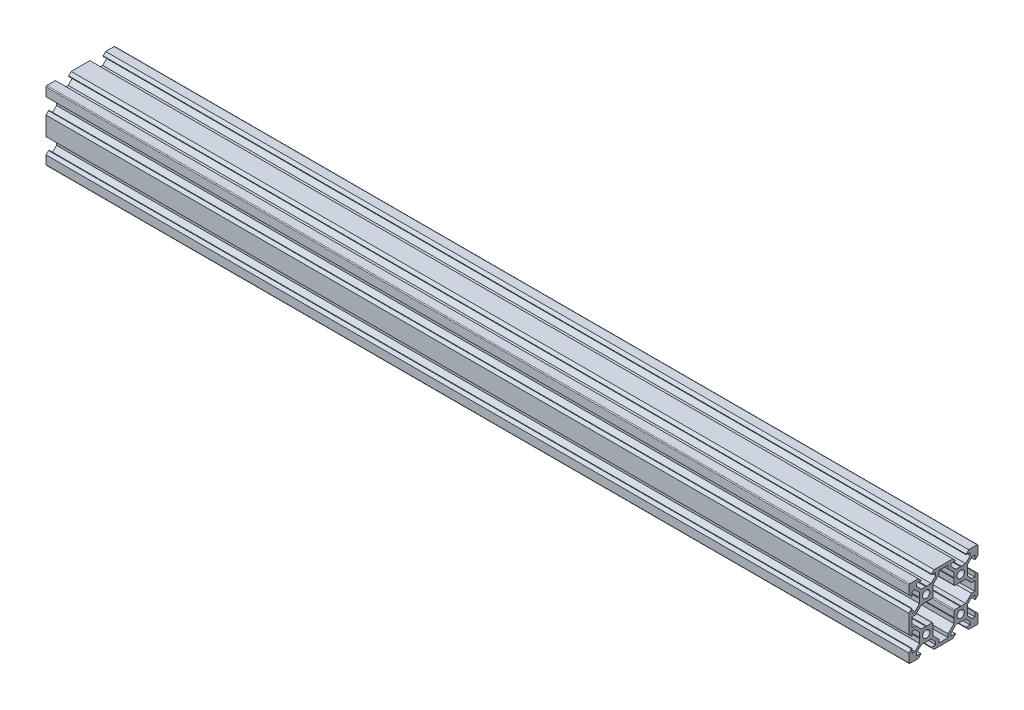
from build123d import *

# Parameters (mm, degrees)
PROFILE_SKETCH_R      = 2.1
PROFILE_EXTRUDE_DEPTH = 500


with BuildPart() as part:
    # Profile Sketch → Profile Extrude (new body)
    with BuildSketch(Plane(origin=(0, 0, 0), x_dir=(0, 0, -1), z_dir=(1, 0, 0))):
        with BuildLine():
            Line((5.42, 10), (0, 10))
            Line((0, 10), (-5.42, 10))
            Line((-5.42, 10), (-6.875, 8.545))
            Line((-6.875, 8.545), (-6.875, 8.2))
            Line((-6.875, 8.2), (-4.5, 8.2))
            Line((-4.5, 8.2), (-4.5, 6.56))
            Line((-4.5, 6.56), (-7.16, 3.9))
            Line((-7.16, 3.9), (-9.79, 3.9))
            Line((-9.79, 3.9), (-10, 3.69))
            Line((-10, 3.69), (-10.21, 3.9))
            Line((-10.21, 3.9), (-12.84, 3.9))
            Line((-12.84, 3.9), (-15.5, 6.56))
            Line((-15.5, 6.56), (-15.5, 8.2))
            Line((-15.5, 8.2), (-13.125, 8.2))
            Line((-13.125, 8.2), (-13.125, 8.545))
            Line((-13.125, 8.545), (-14.58, 10))
            Line((-14.58, 10), (-19.5, 10))
            ThreePointArc((-19.5, 10), (-19.853553391, 9.853553391), (-20, 9.5))
            Line((-20, 9.5), (-20, 4.58))
            Line((-20, 4.58), (-18.545, 3.125))
            Line((-18.545, 3.125), (-18.2, 3.125))
            Line((-18.2, 3.125), (-18.2, 5.5))
            Line((-18.2, 5.5), (-16.56, 5.5))
            Line((-16.56, 5.5), (-13.9, 2.838679656))
            Line((-13.9, 2.838679656), (-13.9, 0.21))
            Line((-13.9, 0.21), (-13.69, 0))
            Line((-13.69, 0), (-13.9, -0.21))
            Line((-13.9, -0.21), (-13.9, -2.838679656))
            Line((-13.9, -2.838679656), (-16.56, -5.5))
            Line((-16.56, -5.5), (-18.2, -5.5))
            Line((-18.2, -5.5), (-18.2, -3.125))
            Line((-18.2, -3.125), (-18.545, -3.125))
            Line((-18.545, -3.125), (-20, -4.58))
            Line((-20, -4.58), (-20, -15.42))
            Line((-20, -15.42), (-18.545, -16.875))
            Line((-18.545, -16.875), (-18.2, -16.875))
            Line((-18.2, -16.875), (-18.2, -14.5))
            Line((-18.2, -14.5), (-16.56, -14.5))
            Line((-16.56, -14.5), (-13.9, -17.161320344))
            Line((-13.9, -17.161320344), (-13.9, -19.79))
            Line((-13.9, -19.79), (-13.69, -20))
            Line((-13.69, -20), (-13.9, -20.21))
            Line((-13.9, -20.21), (-13.9, -22.838679656))
            Line((-13.9, -22.838679656), (-16.56, -25.5))
            Line((-16.56, -25.5), (-18.2, -25.5))
            Line((-18.2, -25.5), (-18.2, -23.125))
            Line((-18.2, -23.125), (-18.545, -23.125))
            Line((-18.545, -23.125), (-20, -24.58))
            Line((-20, -24.58), (-20, -29.5))
            ThreePointArc((-20, -29.5), (-19.853553391, -29.853553391), (-19.5, -30))
            Line((-19.5, -30), (-14.58, -30))
            Line((-14.58, -30), (-13.125, -28.545))
            Line((-13.125, -28.545), (-13.125, -28.2))
            Line((-13.125, -28.2), (-15.5, -28.2))
            Line((-15.5, -28.2), (-15.5, -26.56))
            Line((-15.5, -26.56), (-12.84, -23.9))
            Line((-12.84, -23.9), (-10.21, -23.9))
            Line((-10.21, -23.9), (-10, -23.69))
            Line((-10, -23.69), (-9.79, -23.9))
            Line((-9.79, -23.9), (-7.16, -23.9))
            Line((-7.16, -23.9), (-4.5, -26.56))
            Line((-4.5, -26.56), (-4.5, -28.2))
            Line((-4.5, -28.2), (-6.875, -28.2))
            Line((-6.875, -28.2), (-6.875, -28.545))
            Line((-6.875, -28.545), (-5.42, -30))
            Line((-5.42, -30), (0, -30))
            Line((0, -30), (5.42, -30))
            Line((5.42, -30), (6.875, -28.545))
            Line((6.875, -28.545), (6.875, -28.2))
            Line((6.875, -28.2), (4.5, -28.2))
            Line((4.5, -28.2), (4.5, -26.56))
            Line((4.5, -26.56), (7.16, -23.9))
            Line((7.16, -23.9), (9.79, -23.9))
            Line((9.79, -23.9), (10, -23.69))
            Line((10, -23.69), (10.21, -23.9))
            Line((10.21, -23.9), (12.84, -23.9))
            Line((12.84, -23.9), (15.5, -26.56))
            Line((15.5, -26.56), (15.5, -28.2))
            Line((15.5, -28.2), (13.125, -28.2))
            Line((13.125, -28.2), (13.125, -28.545))
            Line((13.125, -28.545), (14.58, -30))
            Line((14.58, -30), (19.5, -30))
            ThreePointArc((19.5, -30), (19.853553391, -29.853553391), (20, -29.5))
            Line((20, -29.5), (20, -24.58))
            Line((20, -24.58), (18.545, -23.125))
            Line((18.545, -23.125), (18.2, -23.125))
            Line((18.2, -23.125), (18.2, -25.5))
            Line((18.2, -25.5), (16.56, -25.5))
            Line((16.56, -25.5), (13.9, -22.838679656))
            Line((13.9, -22.838679656), (13.9, -20.21))
            Line((13.9, -20.21), (13.69, -20))
            Line((13.69, -20), (13.9, -19.79))
            Line((13.9, -19.79), (13.9, -17.161320344))
            Line((13.9, -17.161320344), (16.56, -14.5))
            Line((16.56, -14.5), (18.2, -14.5))
            Line((18.2, -14.5), (18.2, -16.875))
            Line((18.2, -16.875), (18.545, -16.875))
            Line((18.545, -16.875), (20, -15.42))
            Line((20, -15.42), (20, -4.58))
            Line((20, -4.58), (18.545, -3.125))
            Line((18.545, -3.125), (18.2, -3.125))
            Line((18.2, -3.125), (18.2, -5.5))
            Line((18.2, -5.5), (16.56, -5.5))
            Line((16.56, -5.5), (13.9, -2.838679656))
            Line((13.9, -2.838679656), (13.9, -0.21))
            Line((13.9, -0.21), (13.69, 0))
            Line((13.69, 0), (13.9, 0.21))
            Line((13.9, 0.21), (13.9, 2.838679656))
            Line((13.9, 2.838679656), (16.56, 5.5))
            Line((16.56, 5.5), (18.2, 5.5))
            Line((18.2, 5.5), (18.2, 3.125))
            Line((18.2, 3.125), (18.545, 3.125))
            Line((18.545, 3.125), (20, 4.58))
            Line((20, 4.58), (20, 9.5))
            ThreePointArc((20, 9.5), (19.853553391, 9.853553391), (19.5, 10))
            Line((19.5, 10), (14.58, 10))
            Line((14.58, 10), (13.125, 8.545))
            Line((13.125, 8.545), (13.125, 8.2))
            Line((13.125, 8.2), (15.5, 8.2))
            Line((15.5, 8.2), (15.5, 6.56))
            Line((15.5, 6.56), (12.84, 3.9))
            Line((12.84, 3.9), (10.21, 3.9))
            Line((10.21, 3.9), (10, 3.69))
            Line((10, 3.69), (9.79, 3.9))
            Line((9.79, 3.9), (7.16, 3.9))
            Line((7.16, 3.9), (4.5, 6.56))
            Line((4.5, 6.56), (4.5, 8.2))
            Line((4.5, 8.2), (6.875, 8.2))
            Line((6.875, 8.2), (6.875, 8.545))
            Line((6.875, 8.545), (5.42, 10))
        make_face()
        with Locations((-10, -20)):
            Circle(PROFILE_SKETCH_R, mode=Mode.SUBTRACT)
        with Locations((10, -20)):
            Circle(PROFILE_SKETCH_R, mode=Mode.SUBTRACT)
        with Locations((-10, 0)):
            Circle(PROFILE_SKETCH_R, mode=Mode.SUBTRACT)
        with BuildLine():
            Line((-2.7, 8.2), (2.7, 8.2))
            Line((2.7, 8.2), (2.7, 6.238679656))
            Line((2.7, 6.238679656), (6.1, 2.838679656))
            Line((6.1, 2.838679656), (6.1, 0.21))
            Line((6.1, 0.21), (6.31, 0))
            Line((6.31, 0), (6.1, -0.21))
            Line((6.1, -0.21), (6.1, -3.4))
            ThreePointArc((6.1, -3.4), (6.246446609, -3.753553391), (6.6, -3.9))
            Line((6.6, -3.9), (9.79, -3.9))
            Line((9.79, -3.9), (10, -3.69))
            Line((10, -3.69), (10.21, -3.9))
            Line((10.21, -3.9), (12.84, -3.9))
            Line((12.84, -3.9), (16.23831318, -7.3))
            Line((16.23831318, -7.3), (18.2, -7.3))
            Line((18.2, -7.3), (18.2, -12.7))
            Line((18.2, -12.7), (16.23831318, -12.7))
            Line((16.23831318, -12.7), (12.84, -16.1))
            Line((12.84, -16.1), (10.21, -16.1))
            Line((10.21, -16.1), (10, -16.31))
            Line((10, -16.31), (9.79, -16.1))
            Line((9.79, -16.1), (6.6, -16.1))
            ThreePointArc((6.6, -16.1), (6.246446609, -16.246446609), (6.1, -16.6))
            Line((6.1, -16.6), (6.1, -19.79))
            Line((6.1, -19.79), (6.31, -20))
            Line((6.31, -20), (6.1, -20.21))
            Line((6.1, -20.21), (6.1, -22.838679656))
            Line((6.1, -22.838679656), (2.7, -26.238679656))
            Line((2.7, -26.238679656), (2.7, -28.2))
            Line((2.7, -28.2), (-2.7, -28.2))
            Line((-2.7, -28.2), (-2.7, -26.238679656))
            Line((-2.7, -26.238679656), (-6.1, -22.838679656))
            Line((-6.1, -22.838679656), (-6.1, -20.21))
            Line((-6.1, -20.21), (-6.31, -20))
            Line((-6.31, -20), (-6.1, -19.79))
            Line((-6.1, -19.79), (-6.1, -16.6))
            ThreePointArc((-6.1, -16.6), (-6.246446609, -16.246446609), (-6.6, -16.1))
            Line((-6.6, -16.1), (-9.79, -16.1))
            Line((-9.79, -16.1), (-10, -16.31))
            Line((-10, -16.31), (-10.21, -16.1))
            Line((-10.21, -16.1), (-12.84, -16.1))
            Line((-12.84, -16.1), (-16.23831318, -12.7))
            Line((-16.23831318, -12.7), (-18.2, -12.7))
            Line((-18.2, -12.7), (-18.2, -7.3))
            Line((-18.2, -7.3), (-16.23831318, -7.3))
            Line((-16.23831318, -7.3), (-12.84, -3.9))
            Line((-12.84, -3.9), (-10.21, -3.9))
            Line((-10.21, -3.9), (-10, -3.69))
            Line((-10, -3.69), (-9.79, -3.9))
            Line((-9.79, -3.9), (-6.6, -3.9))
            ThreePointArc((-6.6, -3.9), (-6.246446609, -3.753553391), (-6.1, -3.4))
            Line((-6.1, -3.4), (-6.1, -0.21))
            Line((-6.1, -0.21), (-6.31, 0))
            Line((-6.31, 0), (-6.1, 0.21))
            Line((-6.1, 0.21), (-6.1, 2.838679656))
            Line((-6.1, 2.838679656), (-2.7, 6.238679656))
            Line((-2.7, 6.238679656), (-2.7, 8.2))
        make_face(mode=Mode.SUBTRACT)
        with Locations((10, 0)):
            Circle(PROFILE_SKETCH_R, mode=Mode.SUBTRACT)
    extrude(amount=PROFILE_EXTRUDE_DEPTH)


solid = part.part
